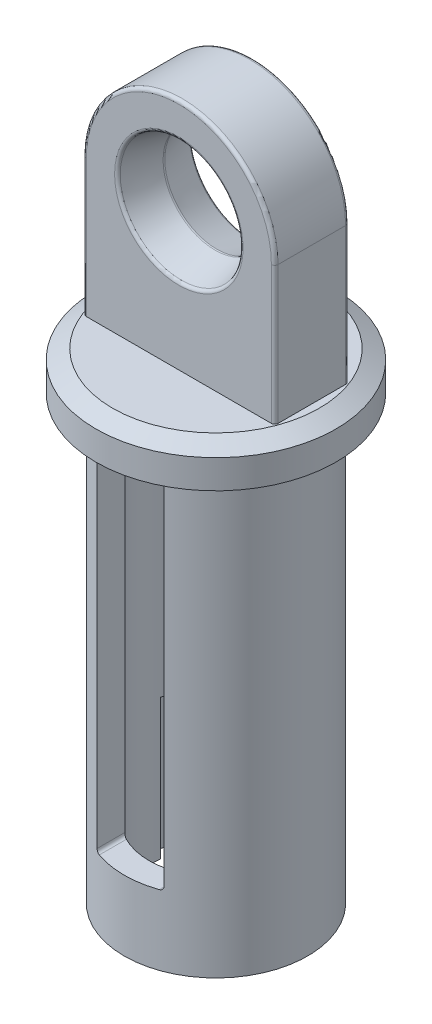
from build123d import *

# Parameters (mm, degrees)
CROQUIS1_R              = 5.5
SALIENTE_EXTRUIR1_DEPTH = 26.5
CROQUIS2_R              = 7.2
SALIENTE_EXTRUIR2_DEPTH = 2.3
CROQUIS3_W              = 11.5
CROQUIS3_H              = 4.45
SALIENTE_EXTRUIR3_DEPTH = 14
CORTAR_EXTRUIR1_DEPTH   = 13.37
CROQUIS6_R              = 4
CORTAR_EXTRUIR2_DEPTH   = 26.5
CROQUIS7_R              = 2.8
CORTAR_EXTRUIR3_DEPTH   = 26.37
CHAFL_N1_SIZE           = 0.9
CHAFL_N1_SIZE2          = 3.358845727
CHAFL_N2_SIZE           = 3.358845727
CHAFL_N2_SIZE_2         = 0.9
REDONDEO1_R             = 0.2
REDONDEO2_R             = 0.2
CROQUIS11_W             = 4
CROQUIS11_H             = 22.3
CORTAR_EXTRUIR4_DEPTH   = 48.550085436
CORTAR_EXTRUIR5_DEPTH   = 8.4
REDONDEO3_R             = 0.2
CHAFL_N3_SIZE           = 1
CHAFL_N3_SIZE2          = 0.577350269


with BuildPart() as part:
    # Croquis1 → Saliente-Extruir1 (new body)
    with BuildSketch(Plane(origin=(0, 0, 0), x_dir=(1, 0, 0), z_dir=(0, 1, 0))):
        with Locations(Location((0, 0, 0), (0, 0, 270))):
            Circle(CROQUIS1_R)
    extrude(amount=SALIENTE_EXTRUIR1_DEPTH)

    # Croquis2 → Saliente-Extruir2 (add)
    with BuildSketch(Plane(origin=(0, 26.5, 0), x_dir=(1, 0, 0), z_dir=(0, 1, 0))):
        with Locations(Location((0, 0, 0), (0, 0, 270))):
            Circle(CROQUIS2_R)
    extrude(amount=SALIENTE_EXTRUIR2_DEPTH)

    # Croquis3 → Saliente-Extruir3 (add)
    with BuildSketch(Plane(origin=(0, 28.8, 0), x_dir=(1, 0, 0), z_dir=(0, 1, 0))):
        Rectangle(CROQUIS3_W, CROQUIS3_H)
    extrude(amount=SALIENTE_EXTRUIR3_DEPTH)

    # Croquis4 → Cortar-Extruir1 (cut)
    with BuildSketch(Plane.XY.offset(2.225)):
        with BuildLine():
            Line((5.75, 42.8), (0, 42.8))
            ThreePointArc((0, 42.8), (4.065863992, 41.115863992), (5.75, 37.05))
            Line((5.75, 37.05), (5.75, 42.8))
        make_face()
        with BuildLine():
            Line((0, 42.8), (-5.75, 42.8))
            Line((-5.75, 42.8), (-5.75, 37.05))
            ThreePointArc((-5.75, 37.05), (-4.065863992, 41.115863992), (0, 42.8))
        make_face()
    extrude(amount=-CORTAR_EXTRUIR1_DEPTH, mode=Mode.SUBTRACT)

    # Croquis6 → Cortar-Extruir2 (cut)
    with BuildSketch(Plane.XZ):
        with Locations(Location((0, 0, 0), (0, 0, 270))):
            Circle(CROQUIS6_R)
    extrude(amount=-CORTAR_EXTRUIR2_DEPTH, mode=Mode.SUBTRACT)

    # Croquis7 → Cortar-Extruir3 (cut)
    with BuildSketch(Plane.XY.offset(2.225)):
        with Locations((0, 37.05)):
            Circle(CROQUIS7_R)
    extrude(amount=-CORTAR_EXTRUIR3_DEPTH, mode=Mode.SUBTRACT)

    # Chaflán1
    chafl_n1_edges = [part.edges().sort_by_distance(p)[0] for p in [
        (-2.8, 37.05, 2.225),
    ]]
    chafl_n1_side = [part.faces().sort_by_distance(p)[0] for p in [
        (0, 28.981176709, 2.225),
    ]]
    chamfer(chafl_n1_edges, length=CHAFL_N1_SIZE, length2=CHAFL_N1_SIZE2, reference=chafl_n1_side[0])

    # Chaflán2
    # the kernel refuses this chamfer: 3.358845727, 0.9 mm, written as the material it takes off along each edge
    with BuildSketch(Plane(origin=(0, 37.05, -2.225), x_dir=(1, 0, 0), z_dir=(0, -1, 0))) as chafl_n2_piece_1:
        Polygon((2.8, CHAFL_N2_SIZE), (2.8 + CHAFL_N2_SIZE_2, 0), (2.8, 0), align=None)
    revolve(axis=Axis((0, 37.05, -2.225), (0, 0, 1)), mode=Mode.SUBTRACT)

    # Redondeo1
    redondeo1_edges = [part.edges().sort_by_distance(p)[0] for p in [
        (-5.75, 32.925, 2.225),
        (-5.75, 32.925, -2.225),
        (0, 42.8, 2.225),
        (0, 42.8, -2.225),
        (5.75, 32.925, -2.225),
        (5.75, 32.925, 2.225),
    ]]
    fillet(redondeo1_edges, radius=REDONDEO1_R)

    # Redondeo2
    redondeo2_edges = [part.edges().sort_by_distance(p)[0] for p in [
        (-3.7, 37.05, 2.225),
        (-3.7, 37.05, -2.225),
        (-3.103813047, 37.05, 0),
    ]]
    fillet(redondeo2_edges, radius=REDONDEO2_R)

    # Croquis11 → Cortar-Extruir4 (cut, through all)
    with BuildSketch(Plane.XY.offset(12.225)):
        with Locations((0, 15.35)):
            Rectangle(CROQUIS11_W, CROQUIS11_H)
    extrude(amount=-CORTAR_EXTRUIR4_DEPTH, mode=Mode.SUBTRACT)

    # Croquis13 → Cortar-Extruir5 (cut)
    with BuildSketch(Plane.XZ):
        with BuildLine():
            Line((-2, -4.19791615), (4.520060123, 1.091584394))
            ThreePointArc((4.520060123, 1.091584394), (3.611110666, 2.929569892), (2, 4.19791615))
            Line((2, 4.19791615), (-4.520060123, -1.091584394))
            ThreePointArc((-4.520060123, -1.091584394), (-3.611110666, -2.929569892), (-2, -4.19791615))
        make_face()
    extrude(amount=-CORTAR_EXTRUIR5_DEPTH, mode=Mode.SUBTRACT)

    # Redondeo3
    redondeo3_edges = [part.edges().sort_by_distance(p)[0] for p in [
        (-2, 4.2, -4.660695766),
        (-2, 4.2, 4.293788499),
        (-2, 26.5, -4.293788499),
        (-2, 26.5, 4.293788499),
        (2, 26.5, 4.293788499),
        (2, 26.5, -4.293788499),
        (2, 4.2, -4.293788499),
        (2, 4.2, 4.660695766),
    ]]
    fillet(redondeo3_edges, radius=REDONDEO3_R)

    # Chaflán3
    chafl_n3_edges = [part.edges().sort_by_distance(p)[0] for p in [
        (0, 28.8, -7.2),
    ]]
    chafl_n3_side = [part.faces().sort_by_distance(p)[0] for p in [
        (-5.953646753, 28.8, 0),
    ]]
    chamfer(chafl_n3_edges, length=CHAFL_N3_SIZE, length2=CHAFL_N3_SIZE2, reference=chafl_n3_side[0])


solid = part.part
